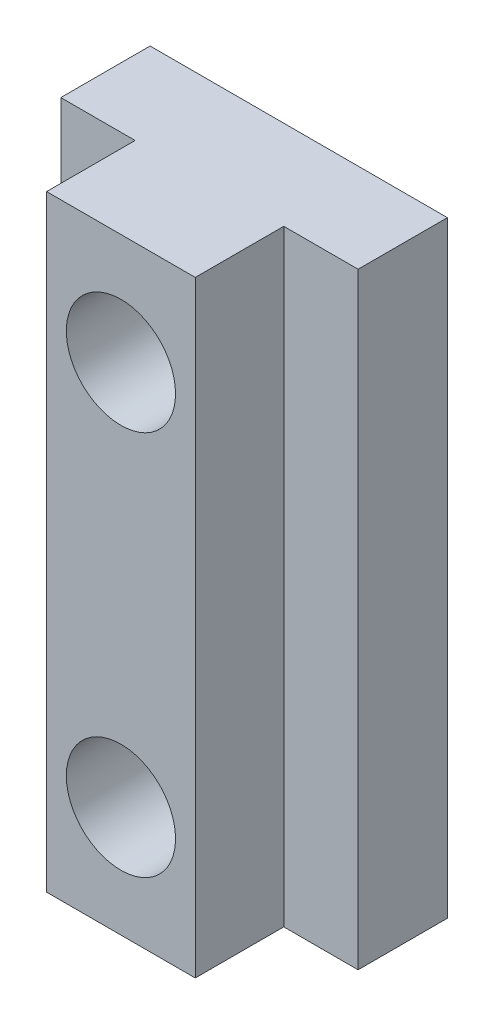
from build123d import *

# Parameters (mm, degrees)
BOSS_EXTRUDE2_DEPTH = 20
SKETCH5_R           = 1.8
CUT_EXTRUDE1_DEPTH  = 4
SKETCH6_R           = 1.25
CUT_EXTRUDE2_DEPTH  = 990.353021007
SKETCH7_W           = 9.9
SKETCH7_H           = 0.15
CUT_EXTRUDE3_DEPTH  = 1685.172011142
SKETCH8_W           = 0.05
SKETCH8_H           = 2.943913803
CUT_EXTRUDE4_DEPTH  = 1685.172011142


with BuildPart() as part:
    # Sketch4 → Boss-Extrude2 (new body)
    with BuildSketch(Plane(origin=(530.949030192, 814.662469053, 1536.164312915), x_dir=(1, 0, 0), z_dir=(0, 1, 0))):
        Polygon((-9.678659284, -55.915046155), (0.221340716, -55.915046155), (0.221340716, -59.008959957), (-2.278659284, -59.008959957), (-2.278659284, -61.926235265), (-7.178659284, -61.926235265), (-7.178659284, -59.008959957), (-9.678659284, -59.008959957), align=None)
    extrude(amount=BOSS_EXTRUDE2_DEPTH)

    # Sketch5 → Cut-Extrude1 (cut)
    with BuildSketch(Plane.XY.offset(1598.09054818)):
        with Locations((526.220370908, 831.012469053)):
            Circle(SKETCH5_R)
        with Locations((526.220370908, 818.312469053)):
            Circle(SKETCH5_R)
    extrude(amount=-CUT_EXTRUDE1_DEPTH, mode=Mode.SUBTRACT)

    # Sketch6 → Cut-Extrude2 (cut, through all)
    with BuildSketch(Plane.XY.offset(1594.09054818)):
        with Locations((526.220370908, 831.012469053)):
            Circle(SKETCH6_R)
        with Locations((526.220370908, 818.312469053)):
            Circle(SKETCH6_R)
    extrude(amount=-CUT_EXTRUDE2_DEPTH, mode=Mode.SUBTRACT)

    # Sketch7 → Cut-Extrude3 (cut, through all)
    with BuildSketch(Plane(origin=(0, 834.662469053, 0), x_dir=(1, 0, 0), z_dir=(0, 1, 0))):
        with Locations((526.220370908, -1592.154359069)):
            Rectangle(SKETCH7_W, SKETCH7_H)
    extrude(amount=-CUT_EXTRUDE3_DEPTH, mode=Mode.SUBTRACT)

    # Sketch8 → Cut-Extrude4 (cut, through all)
    with BuildSketch(Plane(origin=(0, 834.662469053, 0), x_dir=(1, 0, 0), z_dir=(0, 1, 0))):
        with Locations((531.145370908, -1593.701315971)):
            Rectangle(SKETCH8_W, SKETCH8_H)
        with Locations((521.295370908, -1593.701315971)):
            Rectangle(SKETCH8_W, SKETCH8_H)
    extrude(amount=-CUT_EXTRUDE4_DEPTH, mode=Mode.SUBTRACT)


solid = part.part
